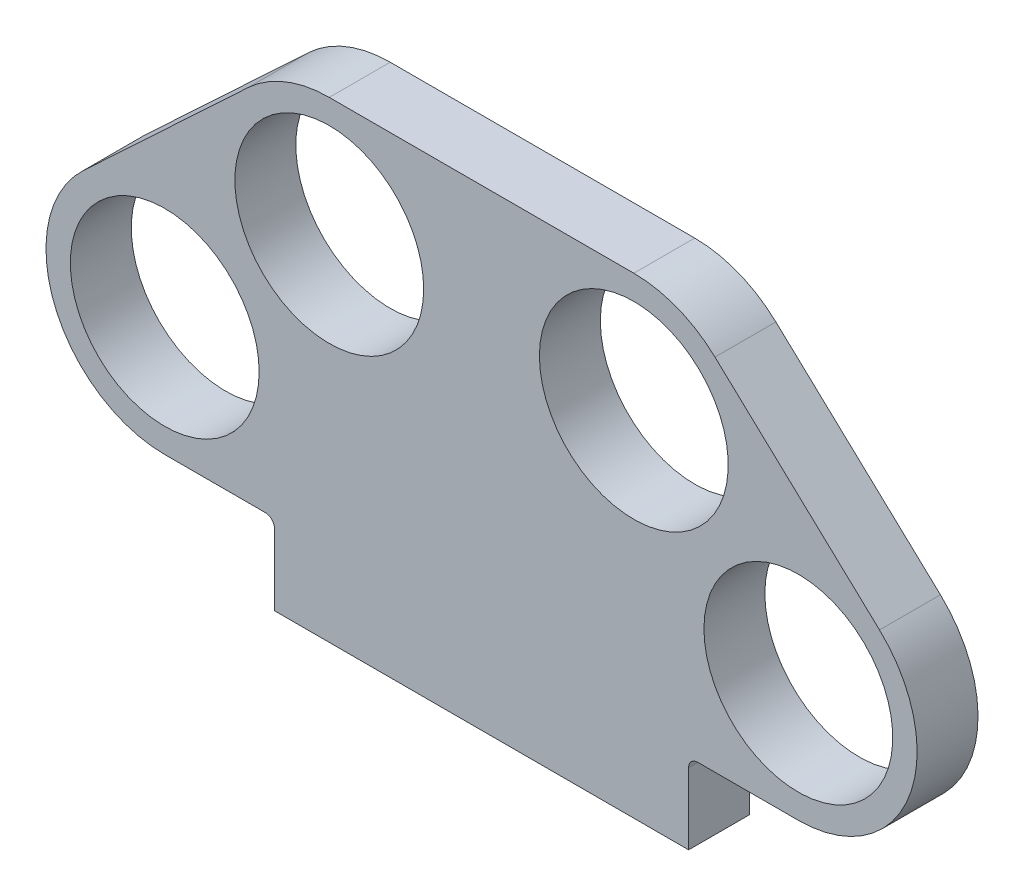
from build123d import *

# Parameters (mm, degrees)
SKETCH1_R           = 7.75
BOSS_EXTRUDE1_DEPTH = 5


with BuildPart() as part:
    # Sketch1 → Boss-Extrude1 (new body)
    with BuildSketch(Plane.XY):
        with BuildLine():
            Line((-19.163161706, 34.1128836), (-32.668957423, 21.469961388))
            ThreePointArc((-32.668957423, 21.469961388), (-35.073932621, 10.769948628), (-26.005795717, 4.602042024))
            Line((-26.005795717, 4.602042024), (-17.75, 4.602042024))
            ThreePointArc((-17.75, 4.602042024), (-17.219669914, 4.38237211), (-17, 3.852042024))
            Line((-17, 3.852042024), (-17, -2))
            Line((-17, -2), (0, -2))
            Line((0, -2), (0, 36.744964236))
            Line((0, 36.744964236), (-12.5, 36.744964236))
            ThreePointArc((-12.5, 36.744964236), (-16.082093396, 36.063101139), (-19.163161706, 34.1128836))
        make_face()
        with Locations((-26.005795717, 14.352042024)):
            Circle(SKETCH1_R, mode=Mode.SUBTRACT)
        with Locations((-12.5, 26.994964236)):
            Circle(SKETCH1_R, mode=Mode.SUBTRACT)
    boss_extrude1 = extrude(amount=BOSS_EXTRUDE1_DEPTH)

    # Mirror1: Boss-Extrude1 across plane
    add(boss_extrude1.mirror(Plane(origin=(0, 0, 0), x_dir=(0, 0, 1), z_dir=(1, 0, 0))))


solid = part.part
